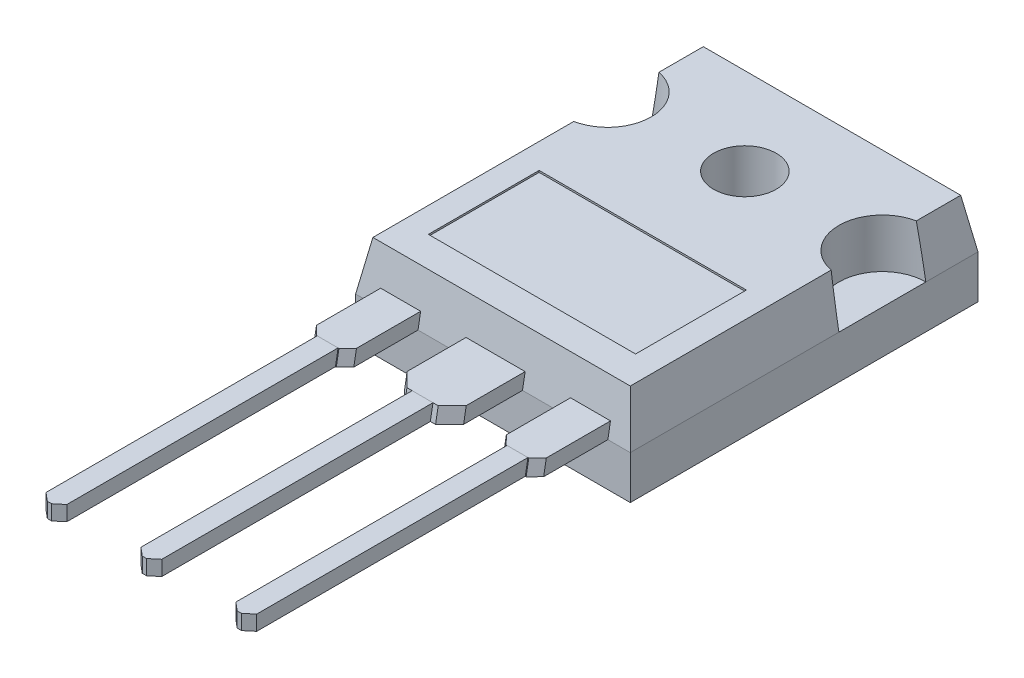
from build123d import *
from OCP.BRepFilletAPI import BRepFilletAPI_MakeChamfer

# Parameters (mm, degrees)
SKETCH1_W             = 15.8
SKETCH1_H             = 20
BOSS_EXTRUDE1_DEPTH   = 2.49
SKETCH2_W             = 15.8
SKETCH2_H             = 20
BOSS_EXTRUDE3_DEPTH   = 2.82
BOSS_EXTRUDE3_TAPER   = 10
BOSS_EXTRUDE4_START   = -1.7
BOSS_EXTRUDE4_DEPTH   = 3.4
BOSS_EXTRUDE4_START_2 = -6.61
BOSS_EXTRUDE4_2_DEPTH = 2.3
BOSS_EXTRUDE4_START_3 = 4.31
BOSS_EXTRUDE4_3_DEPTH = 2.3
BOSS_EXTRUDE6_START   = 14.04836
SKETCH5_W             = 1.2
SKETCH5_H             = 0.86
BOSS_EXTRUDE6_DEPTH   = 16
BOSS_EXTRUDE6_2_DEPTH = 16
BOSS_EXTRUDE6_3_DEPTH = 16
SKETCH6_R             = 1.8
CUT_EXTRUDE1_DEPTH    = 32.519994294
SKETCH7_R             = 2.5
CUT_EXTRUDE2_DEPTH    = 2.82
CHAMFER2_SIZE         = 0.5
CHAMFER3_SIZE         = 0.8
CHAMFER7_SIZE         = 0.4
CHAMFER7_SIZE2        = 0.476701437
CHAMFER8_SIZE         = 0.4
CHAMFER8_SIZE2        = 0.476701437
CHAMFER9_SIZE         = 0.4
CHAMFER9_SIZE2        = 0.476701437
SKETCH9_W             = 12.986336946
SKETCH9_H             = 15.440559179
CUT_EXTRUDE3_DEPTH    = 2.49
SKETCH10_W            = 12.986336946
SKETCH10_H            = 15.440559179
BOSS_EXTRUDE7_DEPTH   = 2.49
SKETCH13_R            = 1.8
CUT_EXTRUDE4_DEPTH    = 2.49
SKETCH14_W            = 11.919281888
SKETCH14_H            = 6.372610916
CUT_EXTRUDE5_DEPTH    = 0.1


# Read off the part's stored shape, not the designer's step: Boss-Extrude4
with BuildPart() as part:
    # Sketch1 → Boss-Extrude1 (new body)
    with BuildSketch(Plane(origin=(0, 0, 0), x_dir=(1, 0, 0), z_dir=(0, 1, 0))):
        Rectangle(SKETCH1_W, SKETCH1_H)
    extrude(amount=BOSS_EXTRUDE1_DEPTH)

    # Sketch2 → Boss-Extrude3 (add)
    with BuildSketch(Plane(origin=(0, 2.49, 0), x_dir=(1, 0, 0), z_dir=(0, 1, 0))):
        Rectangle(SKETCH2_W, SKETCH2_H)
    extrude(amount=BOSS_EXTRUDE3_DEPTH, taper=BOSS_EXTRUDE3_TAPER)

    # Boss-Extrude4 outline → Boss-Extrude4 (add)
    with BuildSketch(Plane.YZ.offset(BOSS_EXTRUDE4_START)):
        Polygon((2.49, 10), (3.35, 9.848358796), (3.35, 14.048358797), (2.49, 14.2), align=None)
    extrude(amount=BOSS_EXTRUDE4_DEPTH)

    # Boss-Extrude4 2 outline → Boss-Extrude4 2 (add)
    with BuildSketch(Plane.YZ.offset(BOSS_EXTRUDE4_START_2)):
        Polygon((2.49, 10), (3.35, 9.848358796), (3.35, 14.048358797), (2.49, 14.2), align=None)
    extrude(amount=BOSS_EXTRUDE4_2_DEPTH)

    # Boss-Extrude4 3 outline → Boss-Extrude4 3 (add)
    with BuildSketch(Plane.YZ.offset(BOSS_EXTRUDE4_START_3)):
        Polygon((2.49, 10), (3.35, 9.848358796), (3.35, 14.048358797), (2.49, 14.2), align=None)
    extrude(amount=BOSS_EXTRUDE4_3_DEPTH)

    # Sketch6 → Cut-Extrude1 (cut, through all)
    with BuildSketch(Plane(origin=(0, 5.31, 0), x_dir=(1, 0, 0), z_dir=(0, 1, 0))):
        with Locations(Location((0, 4.49, 0), (0, 0, 270))):
            Circle(SKETCH6_R)
    extrude(amount=-CUT_EXTRUDE1_DEPTH, mode=Mode.SUBTRACT)

    # Sketch7 → Cut-Extrude2 (cut)
    with BuildSketch(Plane(origin=(0, 5.31, 0), x_dir=(1, 0, 0), z_dir=(0, 1, 0))):
        with Locations((7.9, 4.5)):
            Circle(SKETCH7_R)
        with Locations((-7.9, 4.5)):
            Circle(SKETCH7_R)
    extrude(amount=-CUT_EXTRUDE2_DEPTH, mode=Mode.SUBTRACT)

    # Chamfer2
    chamfer2_edges = [part.edges().sort_by_distance(p)[0] for p in [
        (4.31, 2.92, 14.124179399),
        (6.61, 2.92, 14.124179399),
        (-4.31, 2.92, 14.124179399),
        (-6.61, 2.92, 14.124179399),
    ]]
    chamfer(chamfer2_edges, length=CHAMFER2_SIZE)

    # Chamfer3
    chamfer3_edges = [part.edges().sort_by_distance(p)[0] for p in [
        (1.7, 2.92, 14.124179399),
        (-1.7, 2.92, 14.124179399),
    ]]
    chamfer(chamfer3_edges, length=CHAMFER3_SIZE)

    # Sketch9 → Cut-Extrude3 (cut)
    with BuildSketch(Plane.XZ):
        with Locations((0, -0.672147613)):
            Rectangle(SKETCH9_W, SKETCH9_H)
    extrude(amount=-CUT_EXTRUDE3_DEPTH, mode=Mode.SUBTRACT)

    # Sketch10 → Boss-Extrude7 (add)
    with BuildSketch(Plane.XZ.offset(-2.49)):
        with Locations((0, -0.672147613)):
            Rectangle(SKETCH10_W, SKETCH10_H)
    extrude(amount=BOSS_EXTRUDE7_DEPTH)

    # Sketch13 → Cut-Extrude4 (cut)
    with BuildSketch(Plane(origin=(0, 2.49, 0), x_dir=(1, 0, 0), z_dir=(0, 1, 0))):
        with Locations(Location((0, 4.49, 0), (0, 0, 270))):
            Circle(SKETCH13_R)
    extrude(amount=-CUT_EXTRUDE4_DEPTH, mode=Mode.SUBTRACT)

    # Sketch14 → Cut-Extrude5 (cut)
    with BuildSketch(Plane(origin=(0, 5.31, 0), x_dir=(1, 0, 0), z_dir=(0, 1, 0))):
        with Locations((0, -4.569573217)):
            Rectangle(SKETCH14_W, SKETCH14_H)
    extrude(amount=-CUT_EXTRUDE5_DEPTH, mode=Mode.SUBTRACT)


with BuildPart() as body_2:
    # Sketch5 → Boss-Extrude6 (new body)
    with BuildSketch(Plane.XY.offset(BOSS_EXTRUDE6_START)):
        with Locations((0, 2.92)):
            Rectangle(SKETCH5_W, SKETCH5_H)
    extrude(amount=BOSS_EXTRUDE6_DEPTH)

    # Chamfer7: one chamfer whose edges measure the first distance from different faces: ONE call of the kernel's chamfer builder (chamfer() names one face for all edges)
    chamfer7_edges_1 = [body_2.edges().sort_by_distance(p)[0] for p in [
        (-0.6, 2.92, 30.04836),
    ]]
    chamfer7_side_1 = [body_2.faces().sort_by_distance(p)[0] for p in [
        (-0.6, 2.92, 22.04836),
    ]]
    chamfer7_edges_2 = [body_2.edges().sort_by_distance(p)[0] for p in [
        (0.6, 2.92, 30.04836),
    ]]
    chamfer7_side_2 = [body_2.faces().sort_by_distance(p)[0] for p in [
        (0.6, 2.92, 22.04836),
    ]]
    chamfer7 = BRepFilletAPI_MakeChamfer(body_2.part.solid().wrapped)
    for e in chamfer7_edges_1:
        chamfer7.Add(CHAMFER7_SIZE, CHAMFER7_SIZE2, e.wrapped, chamfer7_side_1[0].wrapped)  # the first distance lies on this face
    for e in chamfer7_edges_2:
        chamfer7.Add(CHAMFER7_SIZE, CHAMFER7_SIZE2, e.wrapped, chamfer7_side_2[0].wrapped)  # the first distance lies on this face
    add(Compound.cast(chamfer7.Shape()), mode=Mode.REPLACE)


with BuildPart() as body_3:
    # Sketch5 → Boss-Extrude6 2 (new body)
    with BuildSketch(Plane.XY.offset(BOSS_EXTRUDE6_START)):
        with Locations((5.46, 2.92)):
            Rectangle(SKETCH5_W, SKETCH5_H)
    extrude(amount=BOSS_EXTRUDE6_2_DEPTH)

    # Chamfer9: one chamfer whose edges measure the first distance from different faces: ONE call of the kernel's chamfer builder (chamfer() names one face for all edges)
    chamfer9_edges_1 = [body_3.edges().sort_by_distance(p)[0] for p in [
        (4.86, 2.92, 30.04836),
    ]]
    chamfer9_side_1 = [body_3.faces().sort_by_distance(p)[0] for p in [
        (4.86, 2.92, 22.04836),
    ]]
    chamfer9_edges_2 = [body_3.edges().sort_by_distance(p)[0] for p in [
        (6.06, 2.92, 30.04836),
    ]]
    chamfer9_side_2 = [body_3.faces().sort_by_distance(p)[0] for p in [
        (6.06, 2.92, 22.04836),
    ]]
    chamfer9 = BRepFilletAPI_MakeChamfer(body_3.part.solid().wrapped)
    for e in chamfer9_edges_1:
        chamfer9.Add(CHAMFER9_SIZE, CHAMFER9_SIZE2, e.wrapped, chamfer9_side_1[0].wrapped)  # the first distance lies on this face
    for e in chamfer9_edges_2:
        chamfer9.Add(CHAMFER9_SIZE, CHAMFER9_SIZE2, e.wrapped, chamfer9_side_2[0].wrapped)  # the first distance lies on this face
    add(Compound.cast(chamfer9.Shape()), mode=Mode.REPLACE)


with BuildPart() as body_4:
    # Sketch5 → Boss-Extrude6 3 (new body)
    with BuildSketch(Plane.XY.offset(BOSS_EXTRUDE6_START)):
        with Locations((-5.46, 2.92)):
            Rectangle(SKETCH5_W, SKETCH5_H)
    extrude(amount=BOSS_EXTRUDE6_3_DEPTH)

    # Chamfer8: one chamfer whose edges measure the first distance from different faces: ONE call of the kernel's chamfer builder (chamfer() names one face for all edges)
    chamfer8_edges_1 = [body_4.edges().sort_by_distance(p)[0] for p in [
        (-4.86, 2.92, 30.04836),
    ]]
    chamfer8_side_1 = [body_4.faces().sort_by_distance(p)[0] for p in [
        (-4.86, 2.92, 22.04836),
    ]]
    chamfer8_edges_2 = [body_4.edges().sort_by_distance(p)[0] for p in [
        (-6.06, 2.92, 30.04836),
    ]]
    chamfer8_side_2 = [body_4.faces().sort_by_distance(p)[0] for p in [
        (-6.06, 2.92, 22.04836),
    ]]
    chamfer8 = BRepFilletAPI_MakeChamfer(body_4.part.solid().wrapped)
    for e in chamfer8_edges_1:
        chamfer8.Add(CHAMFER8_SIZE, CHAMFER8_SIZE2, e.wrapped, chamfer8_side_1[0].wrapped)  # the first distance lies on this face
    for e in chamfer8_edges_2:
        chamfer8.Add(CHAMFER8_SIZE, CHAMFER8_SIZE2, e.wrapped, chamfer8_side_2[0].wrapped)  # the first distance lies on this face
    add(Compound.cast(chamfer8.Shape()), mode=Mode.REPLACE)


solid = Compound([part.part, body_2.part, body_3.part, body_4.part])
